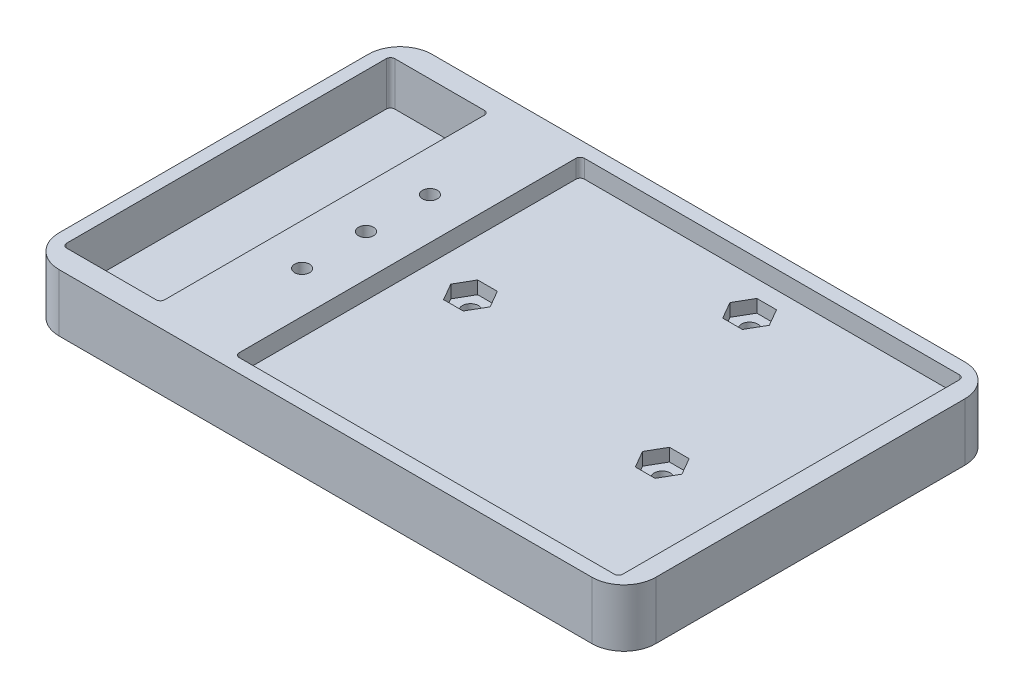
from build123d import *

# Parameters (mm, degrees)
SKETCH1_W             = 140
SKETCH1_H             = 87.5
BOSS_EXTRUDE1_DEPTH   = 13.5
SKETCH2_W             = 90
SKETCH2_H             = 81
CUT_EXTRUDE1_DEPTH    = 4.25
SKETCH5_W             = 23
SKETCH5_H             = 77
CUT_EXTRUDE2_DEPTH    = 10.25
F_6_CLEARANCE_HOLE1_D = 3.7973
CUT_EXTRUDE4_DEPTH    = 3
FILLET1_R             = 7.5
SKETCH15_R            = 1.75
CUT_EXTRUDE3_DEPTH    = 10
FILLET2_R             = 1


with BuildPart() as part:
    # Sketch1 → Boss-Extrude1 (new body)
    with BuildSketch(Plane(origin=(0, 0, 0), x_dir=(1, 0, 0), z_dir=(0, 1, 0))):
        with Locations((70, 43.75)):
            Rectangle(SKETCH1_W, SKETCH1_H)
    extrude(amount=BOSS_EXTRUDE1_DEPTH)

    # Sketch2 → Cut-Extrude1 (cut)
    with BuildSketch(Plane(origin=(0, 13.5, 0), x_dir=(1, 0, 0), z_dir=(0, 1, 0))):
        with Locations((90.5, 43.75)):
            Rectangle(SKETCH2_W, SKETCH2_H)
    extrude(amount=-CUT_EXTRUDE1_DEPTH, mode=Mode.SUBTRACT)

    # Sketch5 → Cut-Extrude2 (cut)
    with BuildSketch(Plane(origin=(0, 13.5, 0), x_dir=(1, 0, 0), z_dir=(0, 1, 0))):
        with Locations((14.5, 43.75)):
            Rectangle(SKETCH5_W, SKETCH5_H)
    extrude(amount=-CUT_EXTRUDE2_DEPTH, mode=Mode.SUBTRACT)

    # #6 Clearance Hole1 (through all)
    with Locations(Plane(origin=(0, 9.25, 0), x_dir=(1, 0, 0), z_dir=(0, 1, 0))):
        with Locations((56.75, 47.25), (93.25, 76.25), (113.25, 35.75)):
            Hole(F_6_CLEARANCE_HOLE1_D / 2)

    # Sketch19 → Cut-Extrude4 (cut)
    with BuildSketch(Plane(origin=(0, 9.25, 0), x_dir=(1, 0, 0), z_dir=(0, 1, 0))):
        Polygon((59.059401077, 51.25), (54.440598923, 51.25), (52.131197846, 47.25), (54.440598923, 43.25), (59.059401077, 43.25), (61.368802154, 47.25), align=None)
        Polygon((97.868802154, 76.25), (95.559401077, 80.25), (90.940598923, 80.25), (88.631197846, 76.25), (90.940598923, 72.25), (95.559401077, 72.25), align=None)
        Polygon((117.868802154, 35.75), (115.559401077, 39.75), (110.940598923, 39.75), (108.631197846, 35.75), (110.940598923, 31.75), (115.559401077, 31.75), align=None)
    extrude(amount=-CUT_EXTRUDE4_DEPTH, mode=Mode.SUBTRACT)

    # Fillet1
    fillet1_edges = [part.edges().sort_by_distance(p)[0] for p in [
        (0, 6.75, 0),
        (0, 6.75, -87.5),
        (140, 6.75, -87.5),
        (140, 6.75, 0),
    ]]
    fillet(fillet1_edges, radius=FILLET1_R)

    # Sketch15 → Cut-Extrude3 (cut)
    with BuildSketch(Plane(origin=(0, 13.5, 0), x_dir=(1, 0, 0), z_dir=(0, 1, 0))):
        with Locations((35.75, 43.75)):
            Circle(SKETCH15_R)
        with Locations((35.75, 58.75)):
            Circle(SKETCH15_R)
        with Locations((35.75, 28.75)):
            Circle(SKETCH15_R)
    extrude(amount=-CUT_EXTRUDE3_DEPTH, mode=Mode.SUBTRACT)

    # Fillet2
    fillet2_edges = [part.edges().sort_by_distance(p)[0] for p in [
        (3, 8.375, -5.25),
        (26, 8.375, -5.25),
        (26, 8.375, -82.25),
        (3, 8.375, -82.25),
        (135.5, 11.375, -3.25),
        (45.5, 11.375, -3.25),
        (135.5, 11.375, -84.25),
        (45.5, 11.375, -84.25),
    ]]
    fillet(fillet2_edges, radius=FILLET2_R)


solid = part.part
